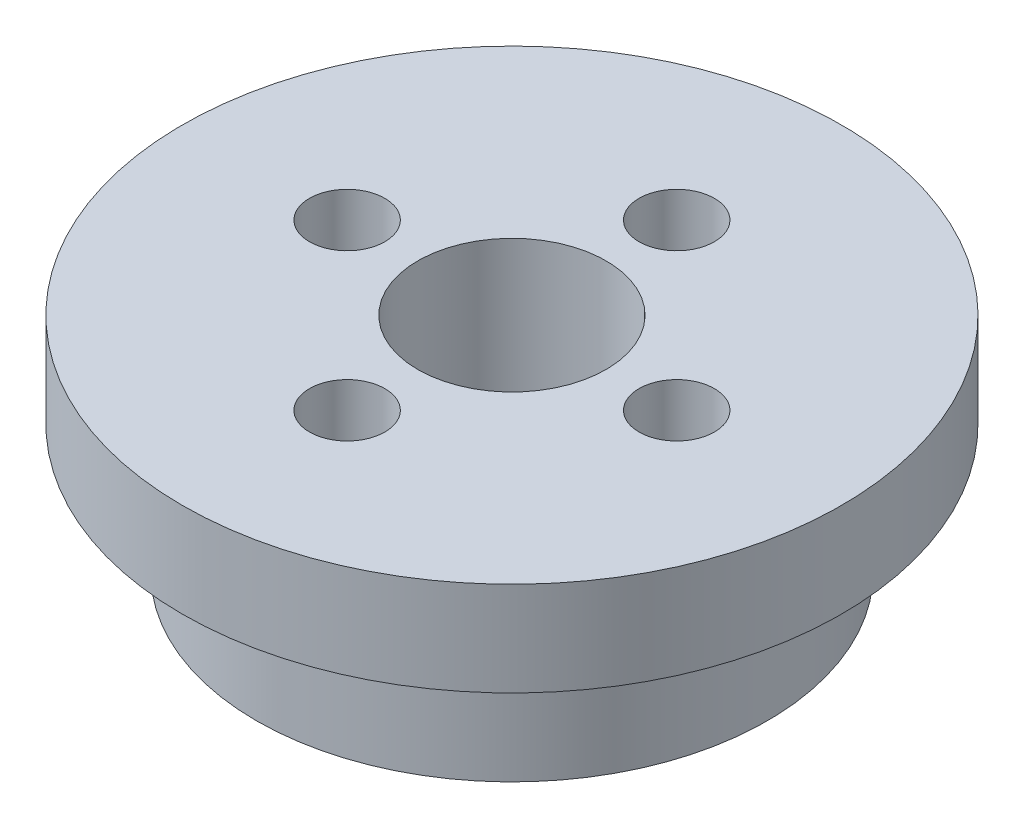
from build123d import *

# Parameters (mm, degrees)
SKETCH_3_R          = 10.85
EXTRUDE_1_DEPTH     = 5.5
SKETCH_4_R          = 14
EXTRUDE_2_DEPTH     = 4
SKETCH_5_R          = 4
SKETCH_5_R_2        = 1.6
CUT_EXTRUDE_1_DEPTH = 50


with BuildPart() as part:
    # 草图3 → 凸台-拉伸1 (new body)
    with BuildSketch(Plane(origin=(0, 0, 0), x_dir=(1, 0, 0), z_dir=(0, 1, 0))):
        Circle(SKETCH_3_R)
    extrude(amount=EXTRUDE_1_DEPTH)

    # 草图4 → 凸台-拉伸2 (add)
    with BuildSketch(Plane(origin=(0, 5.5, 0), x_dir=(1, 0, 0), z_dir=(0, 1, 0))):
        Circle(SKETCH_4_R)
    extrude(amount=EXTRUDE_2_DEPTH)

    # 草图5 → 切除-拉伸1 (cut)
    with BuildSketch(Plane(origin=(0, 9.5, 0), x_dir=(1, 0, 0), z_dir=(0, 1, 0))):
        Circle(SKETCH_5_R)
        with Locations((0, 7)):
            Circle(SKETCH_5_R_2)
        with Locations((7, 0)):
            Circle(SKETCH_5_R_2)
        with Locations((0, -7)):
            Circle(SKETCH_5_R_2)
        with Locations((-7, 0)):
            Circle(SKETCH_5_R_2)
    extrude(amount=-CUT_EXTRUDE_1_DEPTH, mode=Mode.SUBTRACT)


solid = part.part
